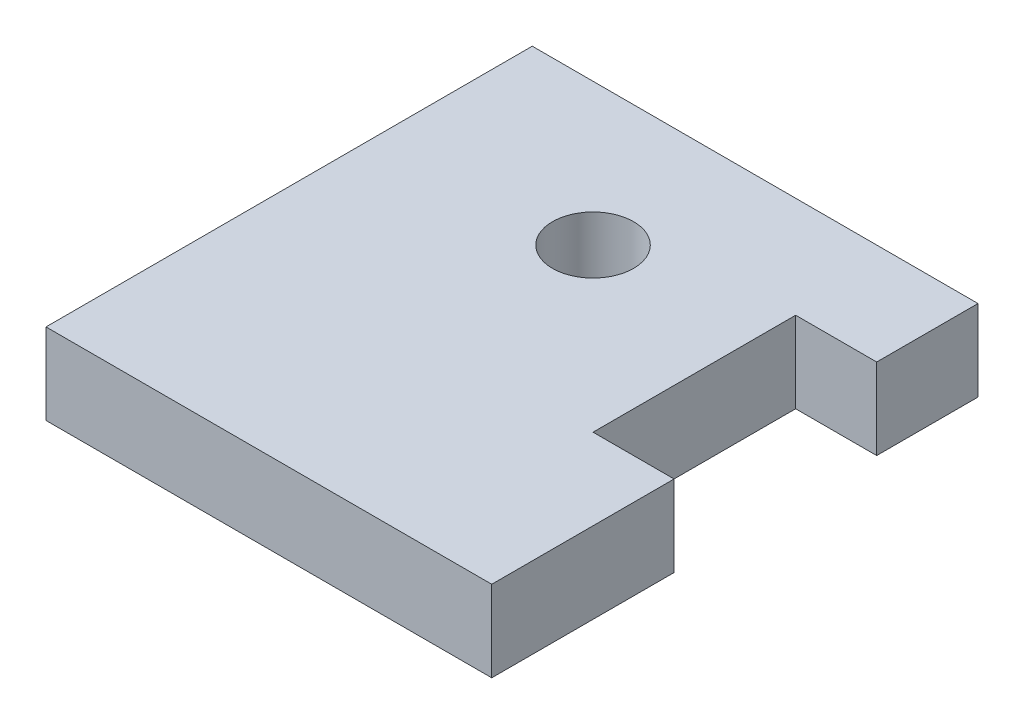
from build123d import *

# Parameters (mm, degrees)
SKETCH1_R           = 2
BOSS_EXTRUDE1_DEPTH = 4


with BuildPart() as part:
    # Sketch1 → Boss-Extrude1 (new body)
    with BuildSketch(Plane(origin=(0, 0, 0), x_dir=(1, 0, 0), z_dir=(0, 1, 0))):
        Polygon((0, 0), (22, 0), (22, 9), (18, 9), (18, 19), (22, 19), (22, 24), (0, 24), align=None)
        with Locations((10, 17)):
            Circle(SKETCH1_R, mode=Mode.SUBTRACT)
    extrude(amount=BOSS_EXTRUDE1_DEPTH)


solid = part.part
